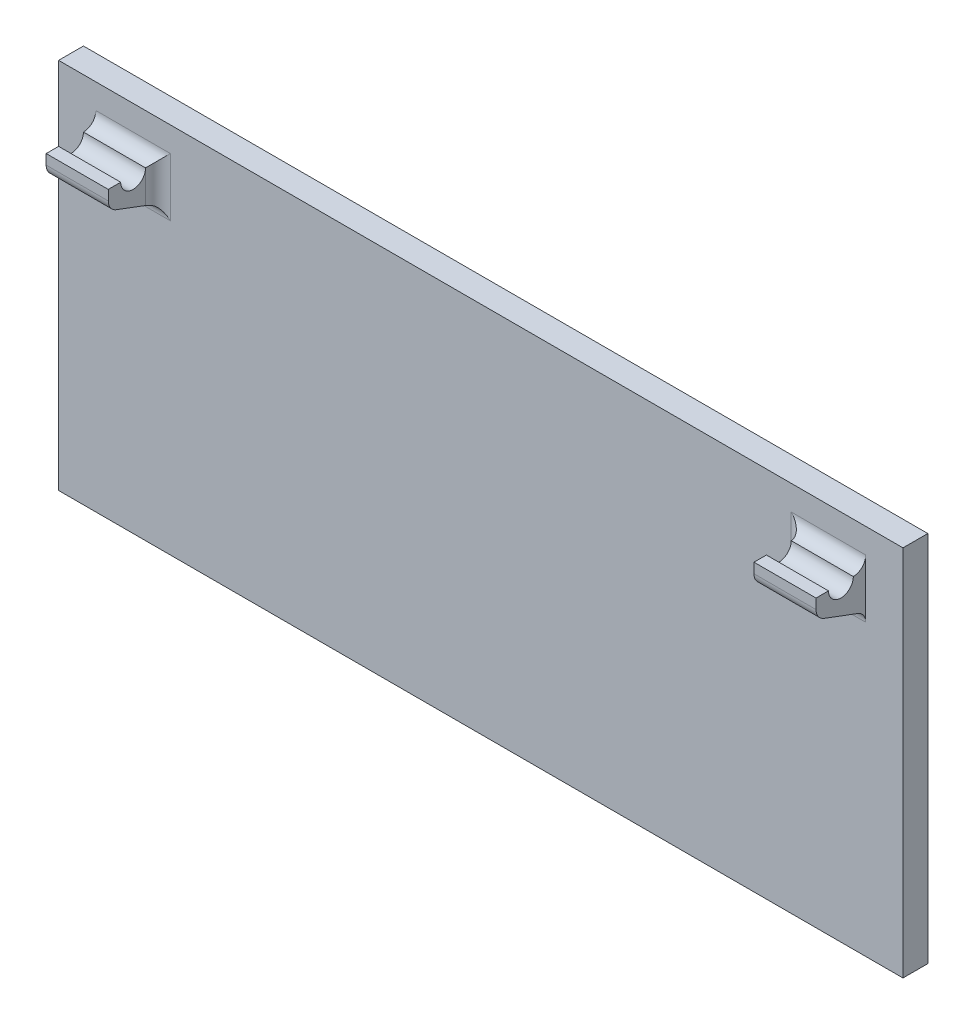
from build123d import *

# Parameters (mm, degrees)
SKETCH1_W                 = 340
SKETCH1_H                 = 150
VERTICAL_PORTION_DEPTH    = 10
SHAFT_ADAPTER_RIGHT_DEPTH = 25
SHAFT_ADAPTER_FILLETS_R   = 5


with BuildPart() as part:
    # Sketch1 → Vertical portion (new body)
    with BuildSketch(Plane.XY):
        Rectangle(SKETCH1_W, SKETCH1_H)
    extrude(amount=VERTICAL_PORTION_DEPTH)

    # Sketch4 → Shaft adapter right (add)
    with BuildSketch(Plane(origin=(155, 0, 0), x_dir=(0, 0, -1), z_dir=(1, 0, 0))):
        with BuildLine():
            Line((-10, 45), (-30, 52.5))
            Line((-30, 52.5), (-30, 60))
            Line((-30, 60), (-25, 60))
            ThreePointArc((-25, 60), (-20, 55), (-15, 60))
            Line((-15, 60), (-10, 60))
            Line((-10, 60), (-10, 55))
            Line((-10, 55), (-10, 45))
        make_face()
    shaft_adapter_right = extrude(amount=-SHAFT_ADAPTER_RIGHT_DEPTH)

    # Shaft adapter left: Shaft adapter right across plane
    add(shaft_adapter_right.mirror(Plane(origin=(0, 0, 0), x_dir=(0, 0, 1), z_dir=(1, 0, 0))))

    # Shaft adapter fillets
    shaft_adapter_fillets_edges = [part.edges().sort_by_distance(p)[0] for p in [
        (-142.5, 52.5, 30),
        (142.5, 52.5, 30),
        (130, 52.5, 10),
        (-130, 52.5, 10),
        (-142.5, 45, 10),
        (142.5, 45, 10),
        (142.5, 60, 10),
        (-142.5, 60, 10),
    ]]
    fillet(shaft_adapter_fillets_edges, radius=SHAFT_ADAPTER_FILLETS_R - 0.0001)  # a hair under: the kernel refuses the full size


solid = part.part
